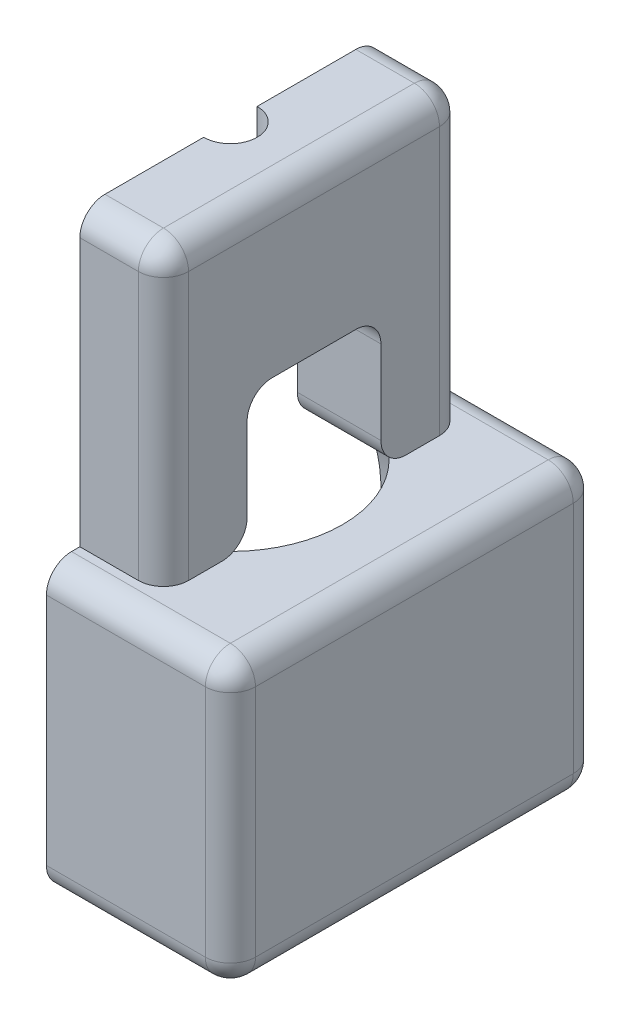
from build123d import *

# Parameters (mm, degrees)
SKETCH_1_W          = 22
SKETCH_1_H          = 17
EXTRUDE_1_DEPTH     = 11
SKETCH_3_W          = 10
SKETCH_3_H          = 17.5
EXTRUDE_2_DEPTH     = 9
SKETCH_4_R          = 1.6
CUT_EXTRUDE_1_DEPTH = 22
SKETCH_5_W          = 8
SKETCH_5_H          = 8
CUT_EXTRUDE_2_DEPTH = 22
FILLET_1_R          = 1.5
FILLET_START        = -6
FILLET_2_DEPTH      = 11
FILLET_START_2      = -5
FILLET_2_2_DEPTH    = 10
SKETCH_7_W          = 37.569031752
SKETCH_7_H          = 53.082934042
CUT_EXTRUDE_4_DEPTH = 22
SKETCH_8_R          = 1
CUT_EXTRUDE_5_DEPTH = 1.5


with BuildPart() as part:
    # 草图1 → 凸台-拉伸1 (new, symmetric)
    with BuildSketch(Plane.XY):
        with Locations((0, -2.5)):
            Rectangle(SKETCH_1_W, SKETCH_1_H)
    extrude(amount=EXTRUDE_1_DEPTH, both=True)

    # 草图2 → 切除-旋转1 (revolve, cut)
    with BuildSketch(Plane.XY, mode=Mode.PRIVATE) as cut_revolve_1_sk:
        with BuildLine():
            Line((0, 6), (6.708203932, 6))
            ThreePointArc((6.708203932, 6), (8.215838363, -3.674234614), (0, -9))
            Line((0, -9), (0, 6))
        make_face()
    revolve(cut_revolve_1_sk.sketch.rotate(Axis((0, 0, 0), (0, 1, 0)), 180), axis=Axis((0, 0, 0), (0, 1, 0)), mode=Mode.SUBTRACT)

    # 草图3 → 凸台-拉伸2 (add, symmetric)
    with BuildSketch(Plane.XY):
        with Locations((0, 14.75)):
            Rectangle(SKETCH_3_W, SKETCH_3_H)
    extrude(amount=EXTRUDE_2_DEPTH, both=True)

    # 草图4 → 切除-拉伸1 (cut)
    with BuildSketch(Plane(origin=(0, 23.5, 0), x_dir=(1, 0, 0), z_dir=(0, 1, 0))):
        with Locations(Location((0, 0, 0), (0, 0, 180))):
            Circle(SKETCH_4_R)
    extrude(amount=-CUT_EXTRUDE_1_DEPTH, mode=Mode.SUBTRACT)

    # 草图5 → 切除-拉伸2 (cut)
    with BuildSketch(Plane.ZY.offset(5)):
        with Locations((0, 10)):
            Rectangle(SKETCH_5_W, SKETCH_5_H)
    extrude(amount=-CUT_EXTRUDE_2_DEPTH, mode=Mode.SUBTRACT)

    # 圆角1
    fillet_1_edges = [part.edges().sort_by_distance(p)[0] for p in [
        (0, -11, 11),
        (11, -2.5, 11),
        (5, 14.75, -9),
        (0, 23.5, -9),
        (5, 23.5, 0),
        (-5, 14.75, -9),
        (-5, 23.5, 0),
        (5, 14.75, 9),
        (0, 23.5, 9),
        (-5, 14.75, 9),
        (0, 6, 11),
        (11, -2.5, -11),
        (0, -11, -11),
        (-11, -2.5, -11),
        (0, 6, -11),
        (11, 6, 0),
        (11, -11, 0),
        (-11, -11, 0),
        (-11, 6, 0),
        (-11, -2.5, 11),
    ]]
    fillet(fillet_1_edges, radius=FILLET_1_R)

    # 圆角2: read off the stored shape, not the designer's step
    # 圆角2 outline → 圆角2 (cut)
    with BuildSketch(Plane.YZ.offset(FILLET_START)):
        with BuildLine():
            Line((6, -4), (6, -5.5))
            ThreePointArc((6, -5.5), (6.439339828, -4.439339828), (7.5, -4))
            Line((7.5, -4), (6, -4))
        make_face()
        with BuildLine():
            Line((6, 4), (7.5, 4))
            ThreePointArc((7.5, 4), (6.439339828, 4.439339828), (6, 5.5))
            Line((6, 5.5), (6, 4))
        make_face()
    extrude(amount=FILLET_2_DEPTH, mode=Mode.SUBTRACT)

    # Fillet 2 2 outline → Fillet 2 2 (add)
    with BuildSketch(Plane.YZ.offset(FILLET_START_2)):
        with BuildLine():
            ThreePointArc((12.5, 4), (13.560660172, 3.560660172), (14, 2.5))
            Line((14, 2.5), (14, 4))
            Line((14, 4), (12.5, 4))
        make_face()
        with BuildLine():
            ThreePointArc((14, -2.5), (13.560660172, -3.560660172), (12.5, -4))
            Line((12.5, -4), (14, -4))
            Line((14, -4), (14, -2.5))
        make_face()
    extrude(amount=FILLET_2_2_DEPTH)

    # 草图7 → 切除-拉伸4 (cut)
    with BuildSketch(Plane(origin=(0, 0, 0), x_dir=(0, 0, -1), z_dir=(1, 0, 0))):
        Rectangle(SKETCH_7_W, SKETCH_7_H)
    extrude(amount=-CUT_EXTRUDE_4_DEPTH, mode=Mode.SUBTRACT)

    # 草图8 → 切除-拉伸5 (cut)
    with BuildSketch(Plane.ZY):
        with Locations((6, 20.5)):
            Circle(SKETCH_8_R)
        with Locations((8.5, -8.5)):
            Circle(SKETCH_8_R)
        with Locations(Location((-6, 20.5, 0), (0, 0, 180))):
            Circle(SKETCH_8_R)
        with Locations(Location((-8.5, -8.5, 0), (0, 0, 180))):
            Circle(SKETCH_8_R)
    extrude(amount=-CUT_EXTRUDE_5_DEPTH, mode=Mode.SUBTRACT)


solid = part.part
